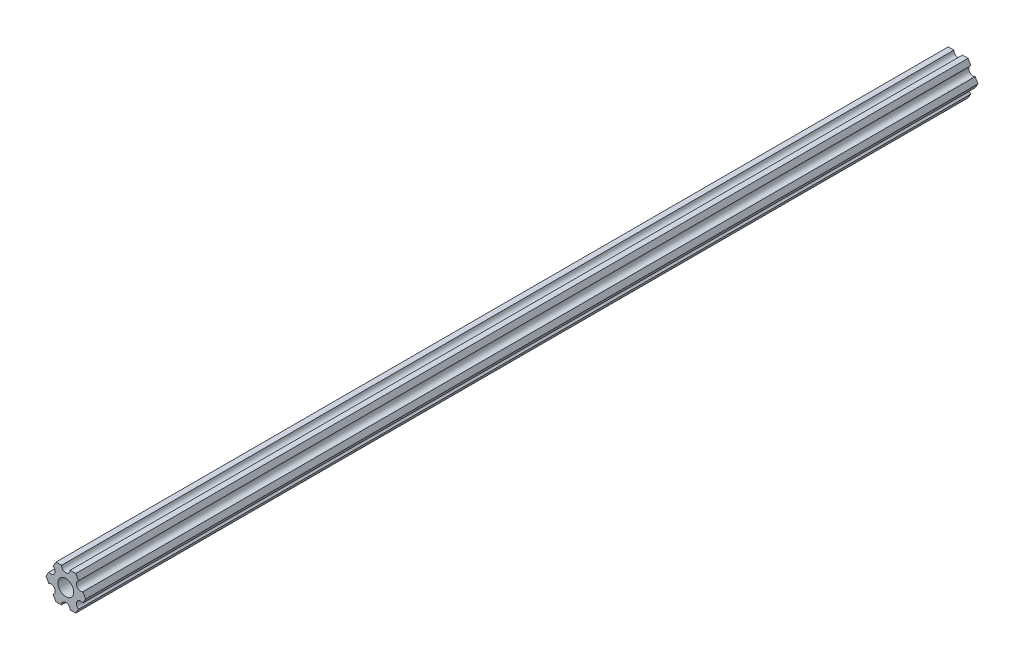
from build123d import *

# Parameters (mm, degrees)
SKETCH1_R           = 2.9337
BOSS_EXTRUDE1_DEPTH = 330.2


with BuildPart() as part:
    # Sketch1 → Boss-Extrude1 (new body)
    with BuildSketch(Plane.XY):
        with BuildLine():
            Line((-4.70551159, -4.549815043), (-3.666174521, -6.349999904))
            Line((-3.666174521, -6.349999904), (-1.587501154, -6.349999904))
            ThreePointArc((-1.587501154, -6.349999904), (-3.85e-07, -4.762499134), (1.587501154, -6.349999904))
            Line((1.587501154, -6.349999904), (3.666173825, -6.349999904))
            Line((3.666173825, -6.349999904), (4.705510929, -4.549815232))
            ThreePointArc((4.705510929, -4.549815232), (4.124445601, -2.381249904), (6.293010929, -1.800184575))
            Line((6.293010929, -1.800184575), (7.332348034, 9.6e-08))
            Line((7.332348034, 9.6e-08), (6.293011178, 1.800184715))
            ThreePointArc((6.293011178, 1.800184715), (4.124445902, 2.381250241), (4.705511428, 4.549815516))
            Line((4.705511428, 4.549815516), (3.666174521, 6.350000222))
            Line((3.666174521, 6.350000222), (1.587498846, 6.350000222))
            ThreePointArc((1.587498846, 6.350000222), (3.85e-07, 4.762501761), (-1.587498846, 6.350000222))
            Line((-1.587498846, 6.350000222), (-3.666173825, 6.350000222))
            Line((-3.666173825, 6.350000222), (-4.705511038, 4.549815614))
            ThreePointArc((-4.705511038, 4.549815614), (-4.124445841, 2.38125025), (-6.293011205, 1.800185053))
            Line((-6.293011205, 1.800185053), (-7.332348419, 4.44e-07))
            Line((-7.332348419, 4.44e-07), (-6.293011423, -1.80018429))
            ThreePointArc((-6.293011423, -1.80018429), (-4.12444613, -2.38124975), (-4.70551159, -4.549815043))
        make_face()
        Circle(SKETCH1_R, mode=Mode.SUBTRACT)
    extrude(amount=-BOSS_EXTRUDE1_DEPTH)


solid = part.part
